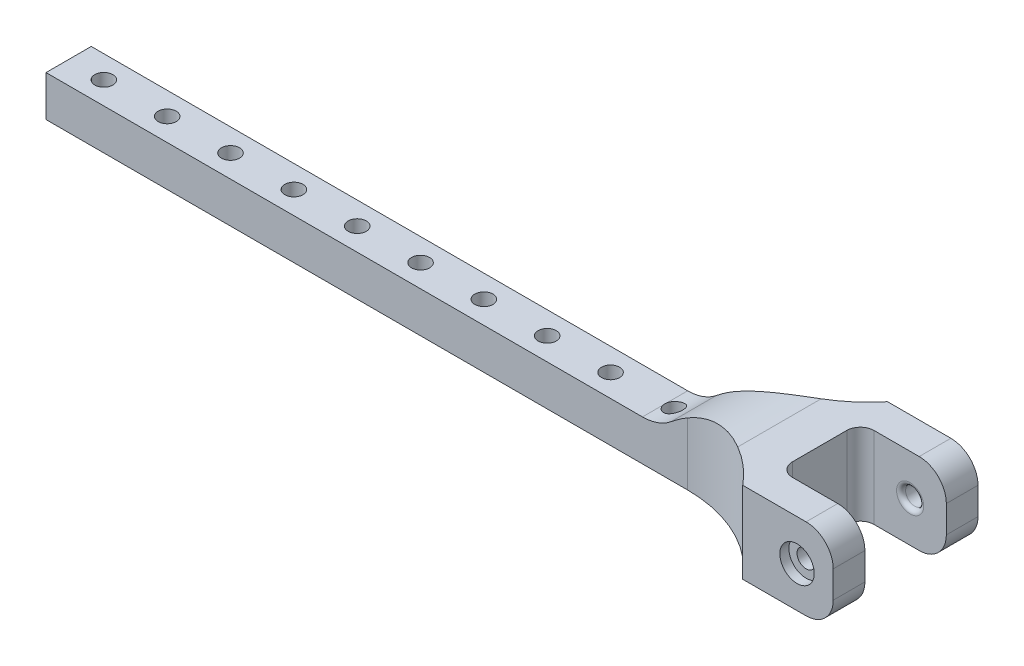
from build123d import *

# Parameters (mm, degrees)
SKETCH1_R           = 1.1
BOSS_EXTRUDE1_DEPTH = 5
BOSS_EXTRUDE2_DEPTH = 9
FILLET1_R           = 15
SKETCH3_R           = 1
CUT_EXTRUDE1_DEPTH  = 16
FILLET2_R           = 3
SKETCH4_R           = 1.9
CUT_EXTRUDE2_DEPTH  = 1
FILLET3_R           = 1.5
FILLET4_R           = 0.5
SKETCH5_W           = 82.891813234
SKETCH5_H           = 4.5
CUT_EXTRUDE3_DEPTH  = 5
SKETCH6_R           = 1
CUT_EXTRUDE4_DEPTH  = 4.5
LPATTERN1_COUNT     = 11
LPATTERN1_PITCH     = 7
FILLET5_R           = 5
FILLET6_R           = 15
SKETCH7_W           = 12
SKETCH7_H           = 5
CUT_EXTRUDE5_DEPTH  = 5
FILLET7_R           = 0.5


with BuildPart() as part:
    # Sketch1 → Boss-Extrude1 (new body)
    with BuildSketch(Plane.XY):
        with BuildLine():
            ThreePointArc((0, 4.5), (-4.5, 0), (0, -4.5))
            Line((0, -4.5), (90, -4.5))
            Line((90, -4.5), (90, 4.5))
            Line((90, 4.5), (0, 4.5))
        make_face()
        Circle(SKETCH1_R, mode=Mode.SUBTRACT)
    extrude(amount=BOSS_EXTRUDE1_DEPTH)

    # Sketch2 → Boss-Extrude2 (add)
    with BuildSketch(Plane(origin=(0, 4.5, 0), x_dir=(1, 0, 0), z_dir=(0, 1, 0))):
        Polygon((90.5, 2), (100, 2), (100, 5.5), (90, 5.5), (90, 0), (90, -5), (90, -10.5), (100, -10.5), (100, -7), (90.5, -7), align=None)
    extrude(amount=-BOSS_EXTRUDE2_DEPTH)

    # Fillet1
    # the kernel refuses this fillet: 15 mm, written as the material it adds along each edge
    with BuildSketch(Plane(origin=(90, -4.5, 0), x_dir=(0, 0, -1), z_dir=(0, 1, 0))) as fillet1_piece_1:
        with BuildLine():
            CenterArc((15, 11.608186766), FILLET1_R, 180, 50.703519761)
            Line((0, 11.608186766), (-0.3, 11.608186766))
            Line((-0.3, 11.608186766), (-0.3, 0))
            Line((-0.3, 0), (0, -0.3))
            ThreePointArc((0, -0.3), (2.75, -0.3), (5.31, -0.232163735))
            Line((5.31, -0.232163735), (5.5, 0))
        make_face()
    extrude(amount=9)
    with BuildSketch(Plane(origin=(90, -4.5, 5), x_dir=(0, 0, 1), z_dir=(0, 1, 0))) as fillet1_piece_2:
        with BuildLine():
            CenterArc((15, -11.608186766), FILLET1_R, 129.296480239, 50.703519761)
            Line((0, -11.608186766), (-0.3, -11.608186766))
            Line((-0.3, -11.608186766), (-0.3, 0))
            Line((-0.3, 0), (0, 0.3))
            ThreePointArc((0, 0.3), (2.75, 0.3), (5.31, 0.232163735))
            Line((5.31, 0.232163735), (5.5, 0))
        make_face()
    extrude(amount=9)

    # Sketch3 → Cut-Extrude1 (cut)
    with BuildSketch(Plane.XY.offset(10.5)):
        with Locations((96, 0)):
            Circle(SKETCH3_R)
    extrude(amount=-CUT_EXTRUDE1_DEPTH, mode=Mode.SUBTRACT)

    # Fillet2
    fillet2_edges = [part.edges().sort_by_distance(p)[0] for p in [
        (100, 4.5, 8.75),
        (100, 4.5, -3.75),
        (100, -4.5, 8.75),
        (100, -4.5, -3.75),
    ]]
    fillet(fillet2_edges, radius=FILLET2_R)

    # Sketch4 → Cut-Extrude2 (cut)
    with BuildSketch(Plane.XY.offset(10.5)):
        with Locations((96, 0)):
            Circle(SKETCH4_R)
    extrude(amount=-CUT_EXTRUDE2_DEPTH, mode=Mode.SUBTRACT)

    # Fillet3
    fillet3_edges = [part.edges().sort_by_distance(p)[0] for p in [
        (90.5, 0, 7),
        (90.5, 0, -2),
    ]]
    fillet(fillet3_edges, radius=FILLET3_R)

    # Fillet4
    fillet4_edges = [part.edges().sort_by_distance(p)[0] for p in [
        (95, 0, -2),
    ]]
    fillet(fillet4_edges, radius=FILLET4_R)

    # Sketch5 → Cut-Extrude3 (cut)
    with BuildSketch(Plane.XY.offset(5)):
        with Locations((36.945906617, 2.25)):
            Rectangle(SKETCH5_W, SKETCH5_H)
    extrude(amount=-CUT_EXTRUDE3_DEPTH, mode=Mode.SUBTRACT)

    # Sketch6 → Cut-Extrude4 (cut)
    with BuildSketch(Plane(origin=(0, 0, 0), x_dir=(1, 0, 0), z_dir=(0, 1, 0))):
        with Locations(Location((74.391813234, -2.5, 0), (0, 0, 270))):
            Circle(SKETCH6_R)
    cut_extrude4 = extrude(amount=-CUT_EXTRUDE4_DEPTH, mode=Mode.SUBTRACT)

    # LPattern1: Cut-Extrude4 ×11
    with Locations(*[(-i * LPATTERN1_PITCH, 0, 0) for i in range(1, LPATTERN1_COUNT)]):
        add(cut_extrude4, mode=Mode.SUBTRACT)

    # Fillet5
    # the kernel refuses this fillet: 5 mm, written as the material it adds along each edge
    with BuildSketch(Plane(origin=(78.391813234, 0, 5), x_dir=(0, 1, 0), z_dir=(0, 0, -1))) as fillet5_piece_1_section:
        with BuildLine():
            CenterArc((5, -4.974937186), FILLET5_R, 95.739170477, 84.260829523)
            Line((0, -4.974937186), (0, 0))
            Line((0, 0), (4.5, 0))
        make_face()
    fillet5_piece_1 = extrude(amount=5, mode=Mode.PRIVATE)
    fillet5_piece_1 = fillet5_piece_1 - Plane(origin=(74.391813234, 1.284484558, 2.5), x_dir=(0, 0, 1), z_dir=(0, 1, 0)) * Cylinder(1, 30, mode=Mode.PRIVATE)
    add(fillet5_piece_1)

    # Fillet6
    fillet6_edges = [part.edges().sort_by_distance(p)[0] for p in [
        (78.391813234, 4.5, 2.5),
    ]]
    fillet(fillet6_edges, radius=FILLET6_R)

    # Sketch7 → Cut-Extrude5 (cut)
    with BuildSketch(Plane(origin=(0, 0, 0), x_dir=(1, 0, 0), z_dir=(0, 1, 0))):
        with Locations((1.5, -2.5)):
            Rectangle(SKETCH7_W, SKETCH7_H)
    extrude(amount=-CUT_EXTRUDE5_DEPTH, mode=Mode.SUBTRACT)

    # Fillet7
    fillet7_edges = [part.edges().sort_by_distance(p)[0] for p in [
        (95, 0, 7),
        (95, 0, -5.5),
    ]]
    fillet(fillet7_edges, radius=FILLET7_R)


solid = part.part
